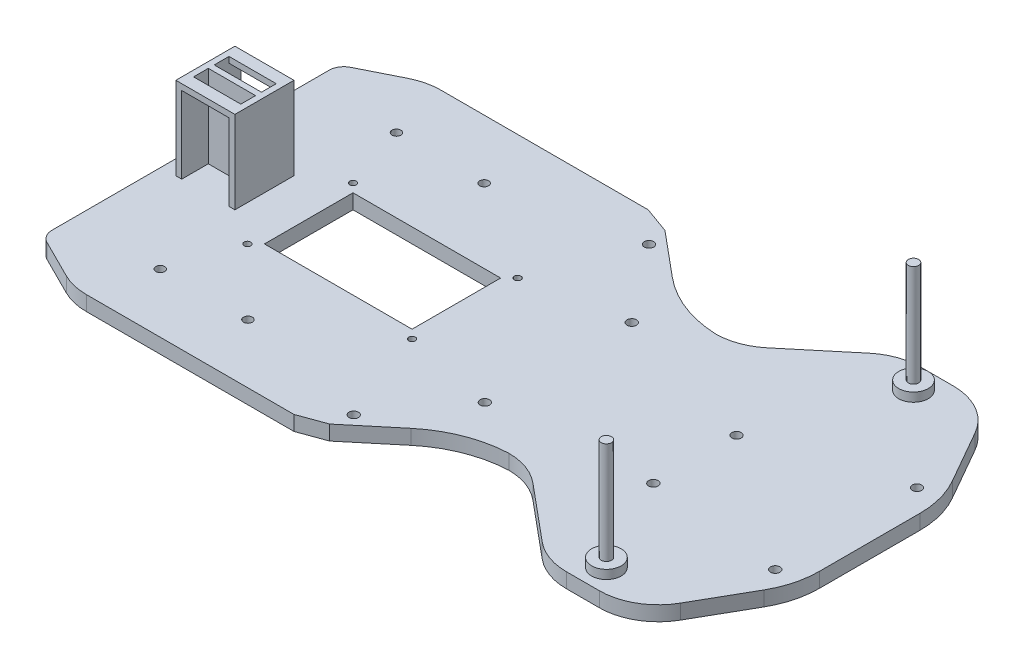
from build123d import *
from OCP.BRepFilletAPI import BRepFilletAPI_MakeChamfer

# Parameters (mm, degrees)
BOSS_EXTRUDE1_DEPTH = 5
CHAMFER1_SIZE       = 5
CHAMFER1_SIZE2      = 5.047084744
FILLET4_R           = 20
FILLET5_R           = 30
FILLET6_R           = 20
FILLET7_R           = 40
FILLET8_R           = 20
FILLET9_R           = 5
CUT_EXTRUDE3_REACH  = 154.398
SKETCH7_R           = 1.5
SKETCH3_R           = 1.75
BOSS_EXTRUDE2_DEPTH = 37.5
SKETCH8_R           = 5
BOSS_EXTRUDE3_DEPTH = 3
SKETCH9_W           = 20
SKETCH9_H           = 20
BOSS_EXTRUDE4_DEPTH = 28
SKETCH12_W          = 16
SKETCH12_H          = 5
CUT_EXTRUDE5_DEPTH  = 28
CUT_EXTRUDE7_REACH  = 164.192
SKETCH13_W          = 16
SKETCH13_H          = 26
CUT_EXTRUDE8_REACH  = 158.864
SKETCH15_R          = 1.125
CUT_EXTRUDE10_REACH = 158.864
SKETCH16_W          = 50
SKETCH16_H          = 30
CUT_EXTRUDE11_REACH = 158.864
SKETCH17_R          = 1.6
CUT_EXTRUDE12_REACH = 158.864
SKETCH18_R          = 1.6
CUT_EXTRUDE13_REACH = 158.864
SKETCH19_R          = 1.6


with BuildPart() as part:
    # Sketch1 → Boss-Extrude1 (new body)
    with BuildSketch(Plane(origin=(0, 0, 0), x_dir=(1, 0, 0), z_dir=(0, 1, 0))):
        Polygon((40, 60), (70, 60), (90, 25), (90, -25), (70, -60), (40, -60), (10, -35), (-10, -35), (-40, -60), (-120, -60), (-140, -50), (-140, 50), (-120, 60), (-40, 60), (-10, 35), (10, 35), align=None)
    extrude(amount=BOSS_EXTRUDE1_DEPTH)

    # Chamfer1: one chamfer whose edges measure the first distance from different faces: ONE call of the kernel's chamfer builder (chamfer() names one face for all edges)
    chamfer1_edges_1 = [part.edges().sort_by_distance(p)[0] for p in [
        (-40, 2.5, 60),
    ]]
    chamfer1_side_1 = [part.faces().sort_by_distance(p)[0] for p in [
        (-80, 2.5, 60),
    ]]
    chamfer1_edges_2 = [part.edges().sort_by_distance(p)[0] for p in [
        (-40, 2.5, -60),
    ]]
    chamfer1_side_2 = [part.faces().sort_by_distance(p)[0] for p in [
        (-25, 2.5, -47.5),
    ]]
    chamfer1 = BRepFilletAPI_MakeChamfer(part.part.solid().wrapped)
    for e in chamfer1_edges_1:
        chamfer1.Add(CHAMFER1_SIZE, CHAMFER1_SIZE2, e.wrapped, chamfer1_side_1[0].wrapped)  # the first distance lies on this face
    for e in chamfer1_edges_2:
        chamfer1.Add(CHAMFER1_SIZE, CHAMFER1_SIZE2, e.wrapped, chamfer1_side_2[0].wrapped)  # the first distance lies on this face
    add(Compound.cast(chamfer1.Shape()), mode=Mode.REPLACE)

    # Fillet4
    fillet4_edges = [part.edges().sort_by_distance(p)[0] for p in [
        (40, 2.5, -60),
        (70, 2.5, -60),
        (70, 2.5, 60),
        (40, 2.5, 60),
    ]]
    fillet(fillet4_edges, radius=FILLET4_R)

    # Fillet5
    fillet5_edges = [part.edges().sort_by_distance(p)[0] for p in [
        (90, 2.5, -25),
        (90, 2.5, 25),
    ]]
    fillet(fillet5_edges, radius=FILLET5_R)

    # Fillet6
    fillet6_edges = [part.edges().sort_by_distance(p)[0] for p in [
        (10, 2.5, 35),
        (10, 2.5, -35),
    ]]
    fillet(fillet6_edges, radius=FILLET6_R)

    # Fillet7
    # the kernel refuses this fillet: 40 mm, written as the material it adds along each edge
    with BuildSketch(Plane(origin=(-10, 0, -35), x_dir=(-0.768221279597376, 0, -0.6401843996644798), z_dir=(0, 1, 0))) as fillet7_piece_1:
        with BuildLine():
            CenterArc((14.420794682, -40), FILLET7_R, 90, 37.26938559)
            Line((-9.801736302, -8.168113585), (0, 0))
            Line((0, 0), (14.420794682, 0))
        make_face()
    extrude(amount=5)
    with BuildSketch(Plane(origin=(-10, 0, 35), x_dir=(1, 0, 0), z_dir=(0, 1, 0))) as fillet7_piece_2:
        with BuildLine():
            CenterArc((14.529014643, -39.96081897), FILLET7_R, 92.536185502, 37.26938559)
            Line((-11.078361343, -9.231967786), (0, 0))
            Line((0, 0), (12.759001296, 0))
        make_face()
    extrude(amount=5)

    # Fillet8
    fillet8_edges = [part.edges().sort_by_distance(p)[0] for p in [
        (-120, 2.5, 60),
        (-120, 2.5, -60),
    ]]
    fillet(fillet8_edges, radius=FILLET8_R)

    # Fillet9
    fillet9_edges = [part.edges().sort_by_distance(p)[0] for p in [
        (-140, 2.5, 50),
        (-140, 2.5, -50),
    ]]
    fillet(fillet9_edges, radius=FILLET9_R)

    # Sketch7 → Cut-Extrude3 (cut, up to next)
    with BuildSketch(Plane(origin=(0, 5, 0), x_dir=(1, 0, 0), z_dir=(0, 1, 0)), mode=Mode.PRIVATE) as cut_extrude3_sk1:
        with Locations(Location((-110.27864045, 40, 0), (0, 0, 270))):
            Circle(SKETCH7_R)
    cut_extrude3_tool1 = extrude(cut_extrude3_sk1.sketch, amount=-CUT_EXTRUDE3_REACH, mode=Mode.PRIVATE) & part.part
    # Sketch7 → Cut-Extrude3 (cut, up to next)
    with BuildSketch(Plane(origin=(0, 5, 0), x_dir=(1, 0, 0), z_dir=(0, 1, 0)), mode=Mode.PRIVATE) as cut_extrude3_sk2:
        with Locations(Location((-80.57864045, 40, 0), (0, 0, 270))):
            Circle(SKETCH7_R)
    cut_extrude3_tool2 = extrude(cut_extrude3_sk2.sketch, amount=-CUT_EXTRUDE3_REACH, mode=Mode.PRIVATE) & part.part
    cut_extrude3_1 = cut_extrude3_tool1.solids().sort_by_distance((-110.27864, 5, -40))[0]
    add(cut_extrude3_1, mode=Mode.SUBTRACT)
    cut_extrude3_2 = cut_extrude3_tool2.solids().sort_by_distance((-80.57864, 5, -40))[0]
    add(cut_extrude3_2, mode=Mode.SUBTRACT)
    cut_extrude3 = cut_extrude3_1 + cut_extrude3_2  # Cut-Extrude3 as one shape, for the pattern or mirror that repeats it

    # Mirror1: Cut-Extrude3 across plane
    add(cut_extrude3.mirror(Plane.XY), mode=Mode.SUBTRACT)

    # Sketch3 → Boss-Extrude2 (add)
    with BuildSketch(Plane(origin=(0, 5, 0), x_dir=(1, 0, 0), z_dir=(0, 1, 0))):
        with Locations(Location((52.817273997, 52, 0), (0, 0, 270))):
            Circle(SKETCH3_R)
        with Locations(Location((52.817273997, -52, 0), (0, 0, 270))):
            Circle(SKETCH3_R)
    extrude(amount=BOSS_EXTRUDE2_DEPTH)

    # Sketch8 → Boss-Extrude3 (add)
    with BuildSketch(Plane(origin=(0, 5, 0), x_dir=(1, 0, 0), z_dir=(0, 1, 0))):
        with Locations(Location((52.817273997, 52, 0), (0, 0, 270))):
            Circle(SKETCH8_R)
        with Locations(Location((52.817273997, -52, 0), (0, 0, 270))):
            Circle(SKETCH8_R)
    extrude(amount=BOSS_EXTRUDE3_DEPTH)

    # Sketch9 → Boss-Extrude4 (add)
    with BuildSketch(Plane(origin=(0, 5, 0), x_dir=(1, 0, 0), z_dir=(0, 1, 0))):
        with Locations((-125, 0)):
            Rectangle(SKETCH9_W, SKETCH9_H)
    extrude(amount=BOSS_EXTRUDE4_DEPTH)

    # Sketch12 → Cut-Extrude5 (cut)
    with BuildSketch(Plane(origin=(0, 33, 0), x_dir=(1, 0, 0), z_dir=(0, 1, 0))):
        with Locations((-125, -3.5)):
            Rectangle(SKETCH12_W, SKETCH12_H)
        with Locations((-125, 3.5)):
            Rectangle(SKETCH12_W, SKETCH12_H)
    extrude(amount=-CUT_EXTRUDE5_DEPTH, mode=Mode.SUBTRACT)

    # Sketch13 → Cut-Extrude7 (cut, up to next)
    with BuildSketch(Plane(origin=(0, 0, -10), x_dir=(-1, 0, 0), z_dir=(0, 0, -1)), mode=Mode.PRIVATE) as cut_extrude7_sk1:
        with Locations((125, 18)):
            Rectangle(SKETCH13_W, SKETCH13_H)
    cut_extrude7_tool1 = extrude(cut_extrude7_sk1.sketch, amount=-CUT_EXTRUDE7_REACH, mode=Mode.PRIVATE) & part.part
    cut_extrude7 = cut_extrude7_tool1.solids().sort_by_distance((-125, 18, -10))[0]
    add(cut_extrude7, mode=Mode.SUBTRACT)

    # Mirror2: Cut-Extrude7 across plane
    add(cut_extrude7.mirror(Plane.XY), mode=Mode.SUBTRACT)

    # Sketch15 → Cut-Extrude8 (cut, up to next)
    with BuildSketch(Plane(origin=(0, 5, 0), x_dir=(1, 0, 0), z_dir=(0, 1, 0)), mode=Mode.PRIVATE) as cut_extrude8_sk1:
        with Locations(Location((-102.875, 17.875, 0), (0, 0, 270))):
            Circle(SKETCH15_R)
    cut_extrude8_tool1 = extrude(cut_extrude8_sk1.sketch, amount=-CUT_EXTRUDE8_REACH, mode=Mode.PRIVATE) & part.part
    # Sketch15 → Cut-Extrude8 (cut, up to next)
    with BuildSketch(Plane(origin=(0, 5, 0), x_dir=(1, 0, 0), z_dir=(0, 1, 0)), mode=Mode.PRIVATE) as cut_extrude8_sk2:
        with Locations(Location((-102.875, -17.875, 0), (0, 0, 270))):
            Circle(SKETCH15_R)
    cut_extrude8_tool2 = extrude(cut_extrude8_sk2.sketch, amount=-CUT_EXTRUDE8_REACH, mode=Mode.PRIVATE) & part.part
    # Sketch15 → Cut-Extrude8 (cut, up to next)
    with BuildSketch(Plane(origin=(0, 5, 0), x_dir=(1, 0, 0), z_dir=(0, 1, 0)), mode=Mode.PRIVATE) as cut_extrude8_sk3:
        with Locations(Location((-47.125, -17.875, 0), (0, 0, 270))):
            Circle(SKETCH15_R)
    cut_extrude8_tool3 = extrude(cut_extrude8_sk3.sketch, amount=-CUT_EXTRUDE8_REACH, mode=Mode.PRIVATE) & part.part
    # Sketch15 → Cut-Extrude8 (cut, up to next)
    with BuildSketch(Plane(origin=(0, 5, 0), x_dir=(1, 0, 0), z_dir=(0, 1, 0)), mode=Mode.PRIVATE) as cut_extrude8_sk4:
        with Locations(Location((-47.125, 17.875, 0), (0, 0, 270))):
            Circle(SKETCH15_R)
    cut_extrude8_tool4 = extrude(cut_extrude8_sk4.sketch, amount=-CUT_EXTRUDE8_REACH, mode=Mode.PRIVATE) & part.part
    add(cut_extrude8_tool1.solids().sort_by_distance((-102.875, 5, -17.875))[0], mode=Mode.SUBTRACT)
    add(cut_extrude8_tool2.solids().sort_by_distance((-102.875, 5, 17.875))[0], mode=Mode.SUBTRACT)
    add(cut_extrude8_tool3.solids().sort_by_distance((-47.125, 5, 17.875))[0], mode=Mode.SUBTRACT)
    add(cut_extrude8_tool4.solids().sort_by_distance((-47.125, 5, -17.875))[0], mode=Mode.SUBTRACT)

    # Sketch16 → Cut-Extrude10 (cut, up to next)
    with BuildSketch(Plane(origin=(0, 5, 0), x_dir=(1, 0, 0), z_dir=(0, 1, 0)), mode=Mode.PRIVATE) as cut_extrude10_sk1:
        with Locations((-75, 0)):
            Rectangle(SKETCH16_W, SKETCH16_H)
    cut_extrude10_tool1 = extrude(cut_extrude10_sk1.sketch, amount=-CUT_EXTRUDE10_REACH, mode=Mode.PRIVATE) & part.part
    add(cut_extrude10_tool1.solids().sort_by_distance((-75, 5, 0))[0], mode=Mode.SUBTRACT)

    # Sketch17 → Cut-Extrude11 (cut, up to next)
    with BuildSketch(Plane(origin=(0, 5, 0), x_dir=(1, 0, 0), z_dir=(0, 1, 0)), mode=Mode.PRIVATE) as cut_extrude11_sk1:
        with Locations(Location((-14.75, 24.16, 0), (0, 0, 270))):
            Circle(SKETCH17_R)
    cut_extrude11_tool1 = extrude(cut_extrude11_sk1.sketch, amount=-CUT_EXTRUDE11_REACH, mode=Mode.PRIVATE) & part.part
    # Sketch17 → Cut-Extrude11 (cut, up to next)
    with BuildSketch(Plane(origin=(0, 5, 0), x_dir=(1, 0, 0), z_dir=(0, 1, 0)), mode=Mode.PRIVATE) as cut_extrude11_sk2:
        with Locations(Location((-16.2, -24.15, 0), (0, 0, 270))):
            Circle(SKETCH17_R)
    cut_extrude11_tool2 = extrude(cut_extrude11_sk2.sketch, amount=-CUT_EXTRUDE11_REACH, mode=Mode.PRIVATE) & part.part
    # Sketch17 → Cut-Extrude11 (cut, up to next)
    with BuildSketch(Plane(origin=(0, 5, 0), x_dir=(1, 0, 0), z_dir=(0, 1, 0)), mode=Mode.PRIVATE) as cut_extrude11_sk3:
        with Locations(Location((36.06, -19.34, 0), (0, 0, 270))):
            Circle(SKETCH17_R)
    cut_extrude11_tool3 = extrude(cut_extrude11_sk3.sketch, amount=-CUT_EXTRUDE11_REACH, mode=Mode.PRIVATE) & part.part
    # Sketch17 → Cut-Extrude11 (cut, up to next)
    with BuildSketch(Plane(origin=(0, 5, 0), x_dir=(1, 0, 0), z_dir=(0, 1, 0)), mode=Mode.PRIVATE) as cut_extrude11_sk4:
        with Locations(Location((36.06, 8.83, 0), (0, 0, 270))):
            Circle(SKETCH17_R)
    cut_extrude11_tool4 = extrude(cut_extrude11_sk4.sketch, amount=-CUT_EXTRUDE11_REACH, mode=Mode.PRIVATE) & part.part
    add(cut_extrude11_tool1.solids().sort_by_distance((-14.75, 5, -24.16))[0], mode=Mode.SUBTRACT)
    add(cut_extrude11_tool2.solids().sort_by_distance((-16.2, 5, 24.15))[0], mode=Mode.SUBTRACT)
    add(cut_extrude11_tool3.solids().sort_by_distance((36.06, 5, 19.34))[0], mode=Mode.SUBTRACT)
    add(cut_extrude11_tool4.solids().sort_by_distance((36.06, 5, -8.83))[0], mode=Mode.SUBTRACT)

    # Sketch18 → Cut-Extrude12 (cut, up to next)
    with BuildSketch(Plane(origin=(0, 5, 0), x_dir=(1, 0, 0), z_dir=(0, 1, 0)), mode=Mode.PRIVATE) as cut_extrude12_sk1:
        with Locations(Location((82, 24, 0), (0, 0, 270))):
            Circle(SKETCH18_R)
    cut_extrude12_tool1 = extrude(cut_extrude12_sk1.sketch, amount=-CUT_EXTRUDE12_REACH, mode=Mode.PRIVATE) & part.part
    # Sketch18 → Cut-Extrude12 (cut, up to next)
    with BuildSketch(Plane(origin=(0, 5, 0), x_dir=(1, 0, 0), z_dir=(0, 1, 0)), mode=Mode.PRIVATE) as cut_extrude12_sk2:
        with Locations(Location((82, -24, 0), (0, 0, 270))):
            Circle(SKETCH18_R)
    cut_extrude12_tool2 = extrude(cut_extrude12_sk2.sketch, amount=-CUT_EXTRUDE12_REACH, mode=Mode.PRIVATE) & part.part
    add(cut_extrude12_tool1.solids().sort_by_distance((82, 5, -24))[0], mode=Mode.SUBTRACT)
    add(cut_extrude12_tool2.solids().sort_by_distance((82, 5, 24))[0], mode=Mode.SUBTRACT)

    # Sketch19 → Cut-Extrude13 (cut, up to next)
    with BuildSketch(Plane(origin=(0, 5, 0), x_dir=(1, 0, 0), z_dir=(0, 1, 0)), mode=Mode.PRIVATE) as cut_extrude13_sk1:
        with Locations(Location((-34.75, -50, 0), (0, 0, 270))):
            Circle(SKETCH19_R)
    cut_extrude13_tool1 = extrude(cut_extrude13_sk1.sketch, amount=-CUT_EXTRUDE13_REACH, mode=Mode.PRIVATE) & part.part
    # Sketch19 → Cut-Extrude13 (cut, up to next)
    with BuildSketch(Plane(origin=(0, 5, 0), x_dir=(1, 0, 0), z_dir=(0, 1, 0)), mode=Mode.PRIVATE) as cut_extrude13_sk2:
        with Locations(Location((-34.75, 50, 0), (0, 0, 270))):
            Circle(SKETCH19_R)
    cut_extrude13_tool2 = extrude(cut_extrude13_sk2.sketch, amount=-CUT_EXTRUDE13_REACH, mode=Mode.PRIVATE) & part.part
    add(cut_extrude13_tool1.solids().sort_by_distance((-34.75, 5, 50))[0], mode=Mode.SUBTRACT)
    add(cut_extrude13_tool2.solids().sort_by_distance((-34.75, 5, -50))[0], mode=Mode.SUBTRACT)


solid = part.part
